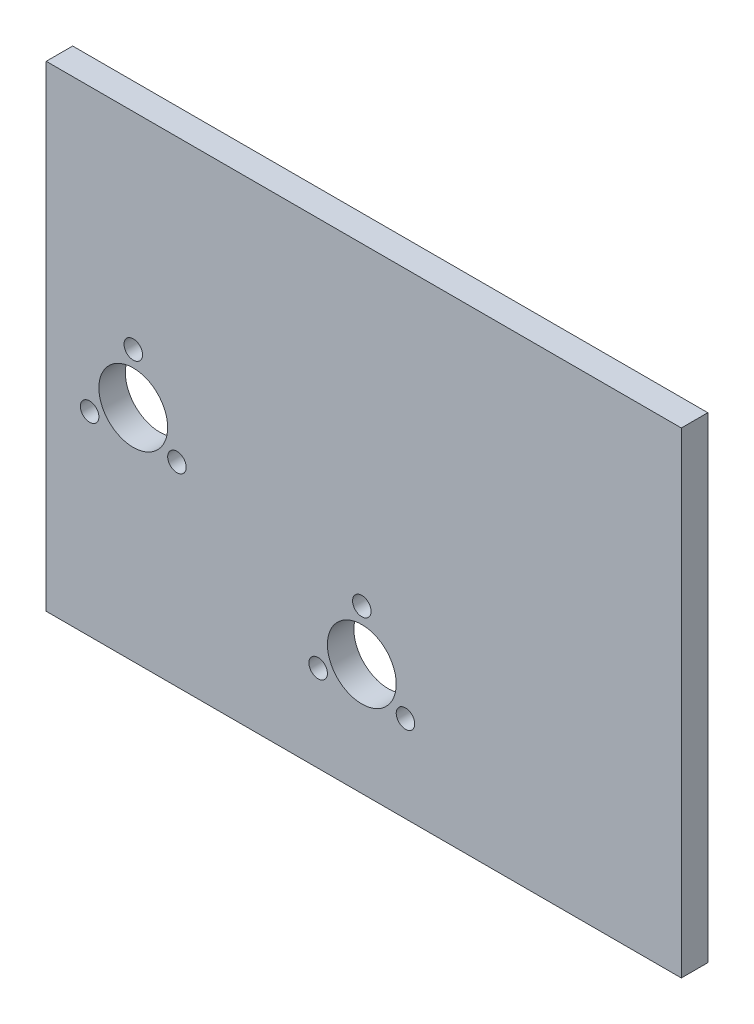
from build123d import *

# Parameters (mm, degrees)
SKETCH_1_W          = 120
SKETCH_1_H          = 90
EXTRUDE_1_DEPTH     = 5
SKETCH_3_R          = 1.75
CUT_EXTRUDE_1_DEPTH = 10
SKETCH_4_R          = 6.5
CUT_EXTRUDE_2_DEPTH = 10


with BuildPart() as part:
    # 草图1 → 凸台-拉伸1 (new body)
    with BuildSketch(Plane.XY):
        Rectangle(SKETCH_1_W, SKETCH_1_H)
    extrude(amount=EXTRUDE_1_DEPTH)

    # 草图3 → 切除-拉伸1 (cut)
    with BuildSketch(Plane(origin=(0, 0, 0), x_dir=(-1, 0, 0), z_dir=(0, 0, -1))):
        with Locations((43.550433762, 6.067082821)):
            Circle(SKETCH_3_R)
        with Locations((0.36794908, -14.325)):
            Circle(SKETCH_3_R)
        with Locations((51.799325733, -8.220417179)):
            Circle(SKETCH_3_R)
        with Locations((35.301541791, -8.220417179)):
            Circle(SKETCH_3_R)
        with Locations((8.616841051, -28.6125)):
            Circle(SKETCH_3_R)
        with Locations((-7.880942891, -28.6125)):
            Circle(SKETCH_3_R)
    extrude(amount=-CUT_EXTRUDE_1_DEPTH, mode=Mode.SUBTRACT)

    # 草图4 → 切除-拉伸2 (cut)
    with BuildSketch(Plane(origin=(0, 0, 0), x_dir=(-1, 0, 0), z_dir=(0, 0, -1))):
        with Locations((0.36794908, -23.85)):
            Circle(SKETCH_4_R)
        with Locations((43.550433762, -3.457917179)):
            Circle(SKETCH_4_R)
    extrude(amount=-CUT_EXTRUDE_2_DEPTH, mode=Mode.SUBTRACT)


solid = part.part
